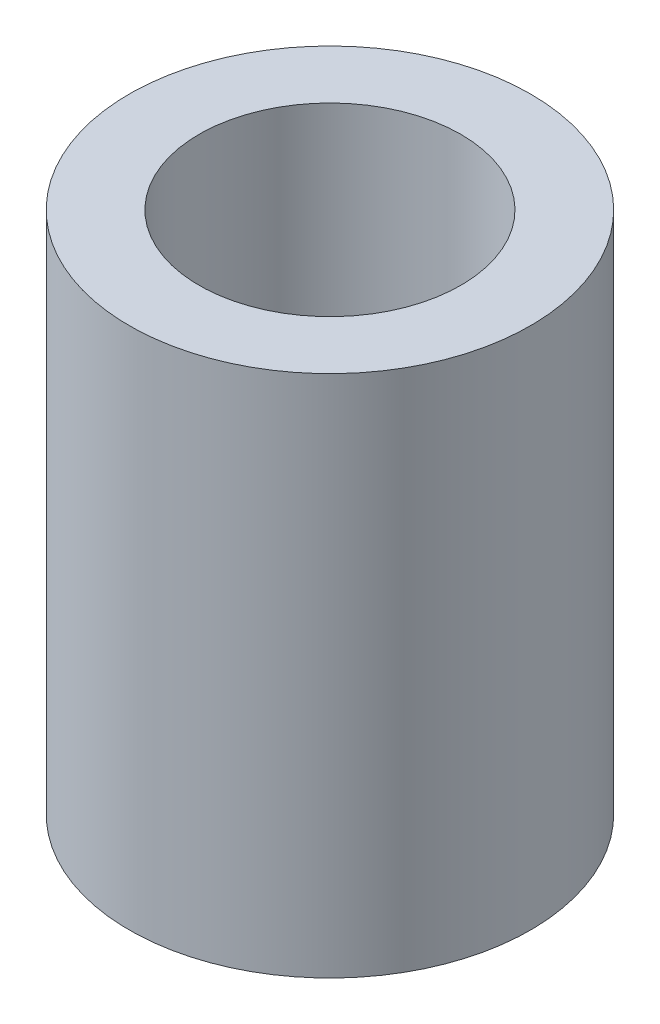
from build123d import *

# Parameters (mm, degrees)
CROQUIS1_W = 8
CROQUIS1_H = 60


with BuildPart() as part:
    # Croquis1 → Revolución1 (revolve)
    with BuildSketch(Plane(origin=(0, 0, 0), x_dir=(0, 0, -1), z_dir=(1, 0, 0))):
        with Locations((19, 30)):
            Rectangle(CROQUIS1_W, CROQUIS1_H)
    revolve(axis=Axis((0, 0, 0), (0, 1, 0)))


solid = part.part
